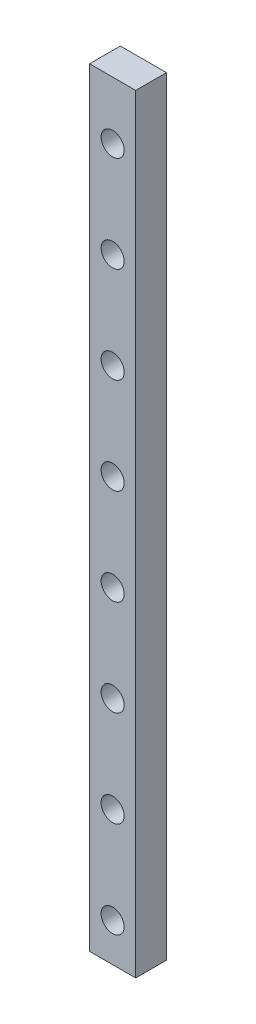
from build123d import *

# Parameters (mm, degrees)
SKETCH_1_W             = 12
SKETCH_1_H             = 8
EXTRUDE_1_DEPTH        = 200
SKETCH_2_R             = 3
CUT_EXTRUDE_1_DEPTH    = 4.5
SKETCH_3_R             = 1.75
CUT_EXTRUDE_2_DEPTH    = 4.5
PATTERN_LINEAR_1_COUNT = 8
PATTERN_LINEAR_1_PITCH = 25


with BuildPart() as part:
    # 草图1 → 凸台-拉伸1 (new body)
    with BuildSketch(Plane(origin=(0, 0, 0), x_dir=(1, 0, 0), z_dir=(0, 1, 0))):
        Rectangle(SKETCH_1_W, SKETCH_1_H)
    extrude(amount=EXTRUDE_1_DEPTH)

    # 草图2 → 切除-拉伸1 (cut)
    with BuildSketch(Plane.XY.offset(4)):
        with Locations((0, 10)):
            Circle(SKETCH_2_R)
    cut_extrude_1 = extrude(amount=-CUT_EXTRUDE_1_DEPTH, mode=Mode.SUBTRACT)

    # 草图3 → 切除-拉伸2 (cut)
    with BuildSketch(Plane.XY.offset(-0.5)):
        with Locations((0, 10)):
            Circle(SKETCH_3_R)
    cut_extrude_2 = extrude(amount=-CUT_EXTRUDE_2_DEPTH, mode=Mode.SUBTRACT)

    # 阵列(线性)1: 切除-拉伸1, 切除-拉伸2 ×8
    with Locations(*[(0, i * PATTERN_LINEAR_1_PITCH, 0) for i in range(1, PATTERN_LINEAR_1_COUNT)]):
        add(cut_extrude_1, mode=Mode.SUBTRACT)
        add(cut_extrude_2, mode=Mode.SUBTRACT)


solid = part.part
